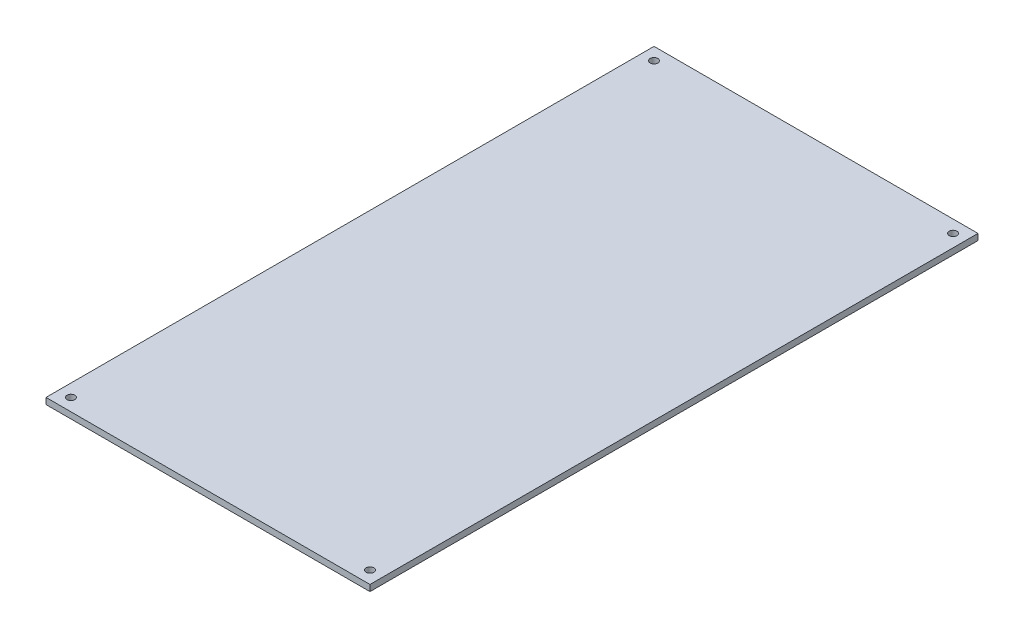
from build123d import *

# Parameters (mm, degrees)
SKETCH1_W           = 330.2
SKETCH1_H           = 619.7
SKETCH1_R           = 3.96875
BOSS_EXTRUDE1_DEPTH = 6.35


with BuildPart() as part:
    # Sketch1 → Boss-Extrude1 (new body)
    with BuildSketch(Plane(origin=(0, -91.8972, 0), x_dir=(1, 0, 0), z_dir=(0, 1, 0))):
        with Locations((-634.099999918, 316.29525)):
            Rectangle(SKETCH1_W, SKETCH1_H)
        with Locations((-481.699999918, 613.44525)):
            Circle(SKETCH1_R, mode=Mode.SUBTRACT)
        with Locations((-786.499999918, 613.44525)):
            Circle(SKETCH1_R, mode=Mode.SUBTRACT)
        with Locations((-786.499999918, 19.14525)):
            Circle(SKETCH1_R, mode=Mode.SUBTRACT)
        with Locations((-481.699999918, 19.14525)):
            Circle(SKETCH1_R, mode=Mode.SUBTRACT)
    extrude(amount=BOSS_EXTRUDE1_DEPTH)


solid = part.part
